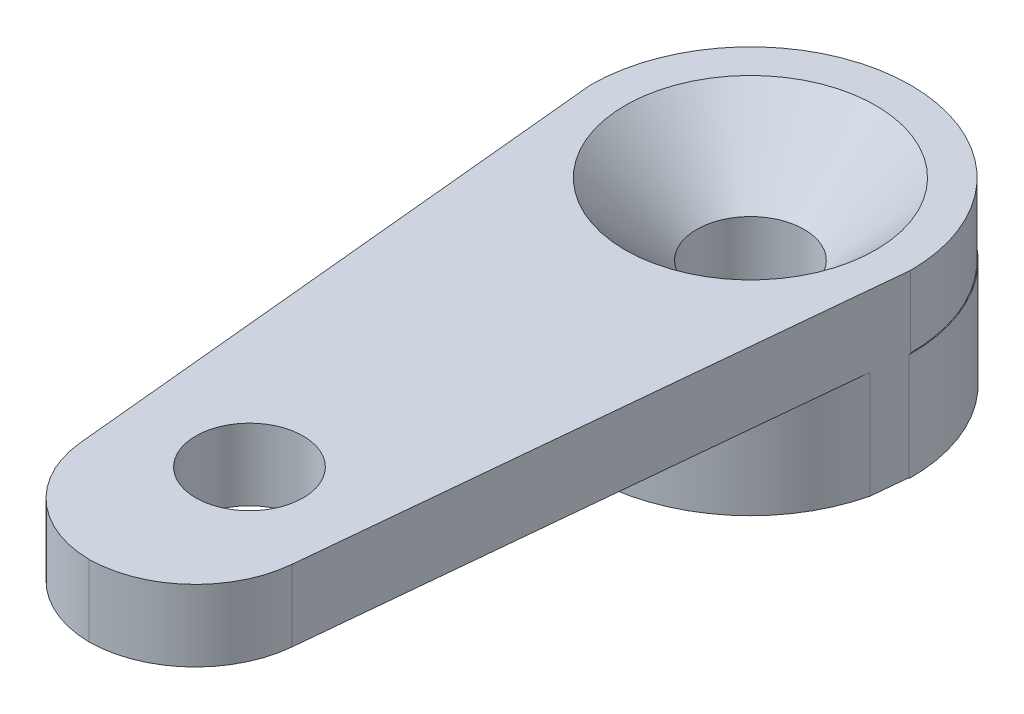
from build123d import *

# Parameters (mm, degrees)
SKETCH1_R           = 4.5
BOSS_EXTRUDE1_DEPTH = 3
BOSS_EXTRUDE2_DEPTH = 2
SKETCH3_R           = 1
CUT_EXTRUDE1_DEPTH  = 2
SKETCH4_R           = 1.5
CUT_EXTRUDE3_DEPTH  = 32
CHAMFER1_SIZE       = 2
CUT_EXTRUDE4_DEPTH  = 32
FILLET1_R           = 3
SKETCH6_R           = 1.5
CUT_EXTRUDE5_DEPTH  = 2


with BuildPart() as part:
    # Sketch1 → Boss-Extrude1 (new body)
    with BuildSketch(Plane(origin=(0, 0, 0), x_dir=(1, 0, 0), z_dir=(0, 1, 0))):
        with Locations(Location((0, 0, 0), (0, 0, 270))):
            Circle(SKETCH1_R)
    extrude(amount=BOSS_EXTRUDE1_DEPTH)

    # Sketch2 → Boss-Extrude2 (add)
    with BuildSketch(Plane(origin=(0, 3, 0), x_dir=(1, 0, 0), z_dir=(0, 1, 0))):
        with BuildLine():
            Line((4.479718811, 0), (4.479718811, -14))
            ThreePointArc((4.479718811, -14), (0, -18.479718811), (-4.479718811, -14))
            Line((-4.479718811, -14), (-4.479718811, 0))
            ThreePointArc((-4.479718811, 0), (0, 4.479718811), (4.479718811, 0))
        make_face()
    extrude(amount=BOSS_EXTRUDE2_DEPTH)

    # Sketch3 → Cut-Extrude1 (cut)
    with BuildSketch(Plane(origin=(0, 5, 0), x_dir=(1, 0, 0), z_dir=(0, 1, 0))):
        with Locations(Location((0, -14, 0), (0, 0, 270))):
            Circle(SKETCH3_R)
    extrude(amount=-CUT_EXTRUDE1_DEPTH, mode=Mode.SUBTRACT)

    # Sketch4 → Cut-Extrude3 (cut)
    with BuildSketch(Plane(origin=(0, 5, 0), x_dir=(1, 0, 0), z_dir=(0, 1, 0))):
        with Locations(Location((0, 0, 0), (0, 0, 270))):
            Circle(SKETCH4_R)
    extrude(amount=-CUT_EXTRUDE3_DEPTH, mode=Mode.SUBTRACT)

    # Chamfer1
    chamfer1_edges = [part.edges().sort_by_distance(p)[0] for p in [
        (0, 5, -1.5),
    ]]
    chamfer(chamfer1_edges, length=CHAMFER1_SIZE)

    # Sketch5 → Cut-Extrude4 (cut)
    with BuildSketch(Plane(origin=(0, 5, 0), x_dir=(1, 0, 0), z_dir=(0, 1, 0))):
        Polygon((4.479718811, 0), (2.781543996, -17.511537216), (5.759954013, -17.140136672), (7.823781183, -10.648462117), align=None)
        Polygon((-4.479718811, 0), (-2.781543996, -17.511537216), (-11.97019759, -15.320216349), align=None)
    extrude(amount=-CUT_EXTRUDE4_DEPTH, mode=Mode.SUBTRACT)

    # Fillet1
    # the kernel refuses this fillet: 3 mm, written as the material it takes off along each edge
    with BuildSketch(Plane(origin=(-2.781543996, 12.615972723, 17.511537216), x_dir=(0.9482948551929795, 0, 0.31739071759351406), z_dir=(0, -1, 0))) as fillet1_piece_1:
        with BuildLine():
            CenterArc((2.026328718, -2.82125448), FILLET1_R, 70.121899875, 85.833982954)
            Line((-0.713367294, -1.59893465), (0, 0))
            ThreePointArc((0, 0), (1.523194545, 0.26690989), (3.046389089, 0))
        make_face()
    extrude(amount=17.231945445, mode=Mode.SUBTRACT)
    with BuildSketch(Plane(origin=(2.781543996, 12.615972723, 17.511537216), x_dir=(-0.9482948551929786, 0, 0.3173907175935166), z_dir=(0, -1, 0))) as fillet1_piece_2:
        with BuildLine():
            CenterArc((2.026328718, 2.82125448), FILLET1_R, 204.044117171, 85.833982954)
            Line((-0.713367294, 1.59893465), (0, 0))
            ThreePointArc((0, 0), (1.523194545, -0.26690989), (3.046389089, 0))
        make_face()
    extrude(amount=17.231945445, mode=Mode.SUBTRACT)

    # Sketch6 → Cut-Extrude5 (cut)
    with BuildSketch(Plane(origin=(0, 5, 0), x_dir=(1, 0, 0), z_dir=(0, 1, 0))):
        with Locations(Location((0, -14, 0), (0, 0, 270))):
            Circle(SKETCH6_R)
    extrude(amount=-CUT_EXTRUDE5_DEPTH, mode=Mode.SUBTRACT)


solid = part.part
